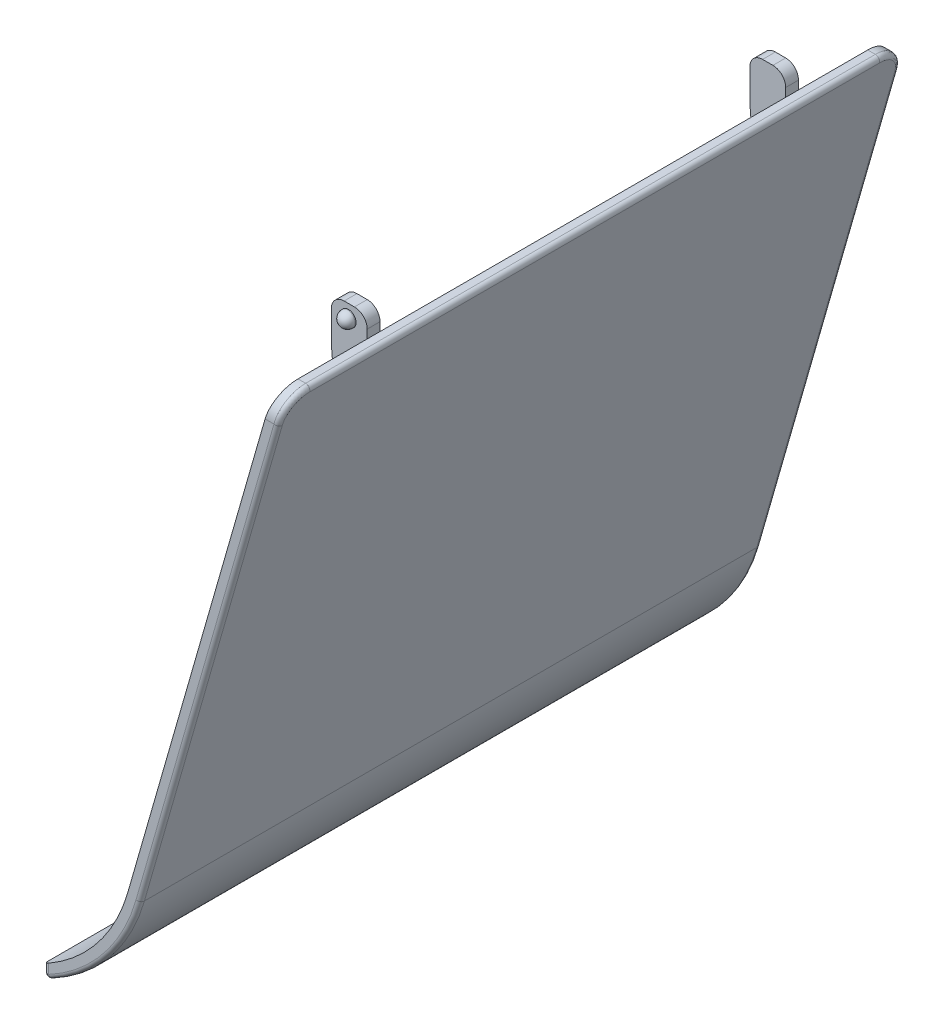
from build123d import *

# Parameters (mm, degrees)
BOSS_EXTRUDE1_DEPTH   = 36.425
CUT_EXTRUDE1_DEPTH    = 109.688749553
CUT_EXTRUDE2_DEPTH    = 108.700665357
FILLET1_R             = 3
BOSS_EXTRUDE12_REACH  = 92.061
BOSS_EXTRUDE12_START  = -4.21
SKETCH27_W            = 1.5
SKETCH27_H            = 5
CUT_EXTRUDE9_REACH    = 101.265
SKETCH30_W            = 0.716863464
SKETCH30_H            = 2.5
SKETCH31_R            = 0.9
BOSS_EXTRUDE13_DEPTH  = 1
FILLET9_R             = 1.5
FILLET10_R            = 1.5
FILLET11_R            = 0.9
FILLET9_OF_MIRROR4_R  = 1.5
FILLET10_OF_MIRROR4_R = 1.5
FILLET11_OF_MIRROR4_R = 0.9
FILLET12_R            = 0.5


with BuildPart() as part:
    # Sketch1 → Boss-Extrude1 (new, symmetric)
    with BuildSketch(Plane.XY):
        with BuildLine():
            Line((0, 0), (-16.960989568, -59.15))
            ThreePointArc((-16.960989568, -59.15), (-22.197903753, -67.931549335), (-31.090696036, -72.977252884))
            Line((-31.090696036, -72.977252884), (-30.708531477, -74.427752884))
            ThreePointArc((-30.708531477, -74.427752884), (-21.148779773, -69.003621568), (-15.519097024, -59.563456034))
            Line((-15.519097024, -59.563456034), (1.441892544, -0.413456034))
            Line((1.441892544, -0.413456034), (1.560449154, 0))
            Line((1.560449154, 0), (0, 0))
        make_face()
    extrude(amount=BOSS_EXTRUDE1_DEPTH, both=True)

    # Sketch2 → Cut-Extrude1 (cut, through all)
    with BuildSketch(Plane.XY.offset(36.425)):
        with BuildLine():
            Line((-31.090696036, -72.977252884), (-26.79397136, -72.977252884))
            ThreePointArc((-26.79397136, -72.977252884), (-28.715962633, -73.797739058), (-30.708531477, -74.427752884))
            Line((-30.708531477, -74.427752884), (-31.090696036, -72.977252884))
        make_face()
    extrude(amount=-CUT_EXTRUDE1_DEPTH, mode=Mode.SUBTRACT)

    # Sketch3 → Cut-Extrude2 (cut, through all)
    with BuildSketch(Plane.XY.offset(36.425)):
        with BuildLine():
            Line((-26.79397136, -72.977252884), (-31.090696036, -72.977252884))
            ThreePointArc((-31.090696036, -72.977252884), (-28.893646337, -72.260311669), (-26.79397136, -71.294704568))
            Line((-26.79397136, -71.294704568), (-26.79397136, -72.977252884))
        make_face()
    extrude(amount=-CUT_EXTRUDE2_DEPTH, mode=Mode.SUBTRACT)

    # Fillet1
    fillet1_edges = [part.edges().sort_by_distance(p)[0] for p in [
        (0.780224577, 0, 36.425),
        (0.780224577, 0, -36.425),
    ]]
    fillet(fillet1_edges, radius=FILLET1_R)

    # Boss-Extrude12: up to this plane
    boss_extrude12_end = Plane(origin=(0, 0, 36.425), z_dir=(0.961261695938318, -0.27563735581700266, 0))
    # Sketch27 → Boss-Extrude12 (add, up to the surface)
    with BuildSketch(Plane(origin=(0, 0, 0), x_dir=(0, 0, -1), z_dir=(1, 0, 0)).offset(BOSS_EXTRUDE12_START), mode=Mode.PRIVATE) as boss_extrude12_sk1:
        with Locations((-24.55, 0)):
            Rectangle(SKETCH27_W, SKETCH27_H)
    boss_extrude12_tool1 = split(extrude(boss_extrude12_sk1.sketch, amount=BOSS_EXTRUDE12_REACH, mode=Mode.PRIVATE), bisect_by=boss_extrude12_end, keep=Keep.BOTH, mode=Mode.PRIVATE)
    boss_extrude12 = boss_extrude12_tool1.solids().sort_by_distance((-4.21, 0, 24.55))[0]
    add(boss_extrude12)

    # Sketch30 → Cut-Extrude9 (cut, up to next)
    with BuildSketch(Plane.XY.offset(25.3), mode=Mode.PRIVATE) as cut_extrude9_sk1:
        with Locations((0.358431732, 1.25)):
            Rectangle(SKETCH30_W, SKETCH30_H)
    cut_extrude9_tool1 = extrude(cut_extrude9_sk1.sketch, amount=-CUT_EXTRUDE9_REACH, mode=Mode.PRIVATE) & part.part
    cut_extrude9 = cut_extrude9_tool1.solids().sort_by_distance((0.358432, 1.25, 25.3))[0]
    add(cut_extrude9, mode=Mode.SUBTRACT)

    # Sketch31 → Boss-Extrude13 (add)
    with BuildSketch(Plane.XY.offset(25.3)):
        with Locations(Location((-2.21, 1, 0), (0, 0, 180))):
            Circle(SKETCH31_R)
    boss_extrude13 = extrude(amount=BOSS_EXTRUDE13_DEPTH)

    # Fillet9
    fillet9_edges = [part.edges().sort_by_distance(p)[0] for p in [
        (-4.21, 2.5, 24.55),
    ]]
    fillet(fillet9_edges, radius=FILLET9_R)

    # Fillet10
    fillet10_edges = [part.edges().sort_by_distance(p)[0] for p in [
        (0, 2.5, 24.55),
    ]]
    fillet(fillet10_edges, radius=FILLET10_R)

    # Fillet11
    fillet11_edges = [part.edges().sort_by_distance(p)[0] for p in [
        (-1.31, 1, 26.3),
    ]]
    fillet(fillet11_edges, radius=FILLET11_R)

    # Mirror4: Boss-Extrude12, Cut-Extrude9, Boss-Extrude13 across plane
    add(boss_extrude12.mirror(Plane.XY))
    add(cut_extrude9.mirror(Plane.XY), mode=Mode.SUBTRACT)
    add(boss_extrude13.mirror(Plane.XY))

    # Fillet9 of Mirror4
    fillet9_of_mirror4_edges = [part.edges().sort_by_distance(p)[0] for p in [
        (-4.21, 2.5, -24.55),
    ]]
    fillet(fillet9_of_mirror4_edges, radius=FILLET9_OF_MIRROR4_R)

    # Fillet10 of Mirror4
    fillet10_of_mirror4_edges = [part.edges().sort_by_distance(p)[0] for p in [
        (0, 2.5, -24.55),
    ]]
    fillet(fillet10_of_mirror4_edges, radius=FILLET10_OF_MIRROR4_R)

    # Fillet11 of Mirror4
    fillet11_of_mirror4_edges = [part.edges().sort_by_distance(p)[0] for p in [
        (-1.31, 1, -26.3),
    ]]
    fillet(fillet11_of_mirror4_edges, radius=FILLET11_OF_MIRROR4_R)

    # Fillet12
    fillet12_edges = [part.edges().sort_by_distance(p)[0] for p in [
        (-7.409442014, -31.281728017, 36.425),
        (-19.727971855, -67.471122669, -36.425),
        (-19.727971855, -67.471122669, 36.425),
        (-26.79397136, -72.977252884, 0),
        (-26.79397136, -72.135978726, -36.425),
        (-26.79397136, -72.135978726, 36.425),
        (1.560449154, 0, 0),
        (1.302457732, -0.899723012, 35.567156991),
        (1.302457732, -0.899723012, -35.567156991),
        (-7.409442014, -31.281728017, -36.425),
    ]]
    fillet(fillet12_edges, radius=FILLET12_R)

    # Chamfer1
    # the kernel refuses this chamfer: 10, 3.5 mm, written as the material it adds along each edge
    with BuildSketch(Plane(origin=(-0.716863464, -2.5, 25.3), x_dir=(-0.26268080042718933, -0.9648827892997839, 0), z_dir=(0, 0, -1))) as chamfer1_piece_1_section:
        with BuildLine():
            Line((10.375794366, 0), (0.542683512, 3.511617253))
            Line((0.542683512, 3.511617253), (0.349706955, 3.564153413))
            ThreePointArc((0.349706955, 3.564153413), (0.270766903, 1.755965125), (-0.192976558, 0.05253616))
            Line((-0.192976558, 0.05253616), (0.00269055, -0.199981902))
            ThreePointArc((0.00269055, -0.199981902), (5.189648845, -0.130196738), (10.378484916, -0.199981902))
            Line((10.378484916, -0.199981902), (10.375794366, 0))
        make_face()
    chamfer1_piece_1 = extrude(amount=1.5, mode=Mode.PRIVATE)
    chamfer1_piece_1 = split(chamfer1_piece_1, bisect_by=Plane(origin=(-4.21, -5.808119571, 24.55), z_dir=(1, 0, 0)), keep=Keep.TOP, mode=Mode.PRIVATE)
    add(chamfer1_piece_1)
    with BuildSketch(Plane(origin=(-0.716863464, -2.5, -25.3), x_dir=(-0.26268080042718933, -0.9648827892997839, 0), z_dir=(0, 0, 1))) as chamfer1_piece_2_section:
        with BuildLine():
            Line((10.375794366, 0), (0.542683512, -3.511617253))
            Line((0.542683512, -3.511617253), (0.349706955, -3.564153413))
            ThreePointArc((0.349706955, -3.564153413), (0.270766903, -1.755965125), (-0.192976558, -0.05253616))
            Line((-0.192976558, -0.05253616), (0.00269055, 0.199981902))
            ThreePointArc((0.00269055, 0.199981902), (5.189648845, 0.130196738), (10.378484916, 0.199981902))
            Line((10.378484916, 0.199981902), (10.375794366, 0))
        make_face()
    chamfer1_piece_2 = extrude(amount=1.5, mode=Mode.PRIVATE)
    chamfer1_piece_2 = split(chamfer1_piece_2, bisect_by=Plane(origin=(-4.21, -5.808119571, -24.55), z_dir=(1, 0, 0)), keep=Keep.TOP, mode=Mode.PRIVATE)
    add(chamfer1_piece_2)


solid = part.part
